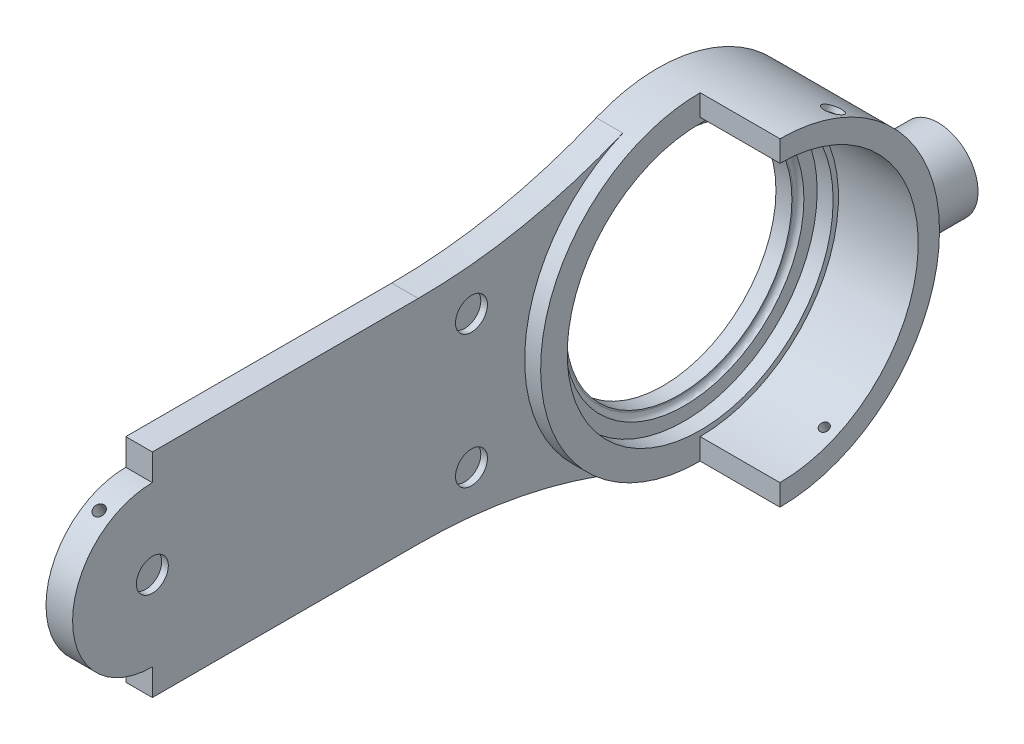
from build123d import *

# Parameters (mm, degrees)
SKETCH1_R                                            = 60
SKETCH1_R_2                                          = 45
SKETCH1_R_3                                          = 40
BOSS_EXTRUDE3_DEPTH                                  = 10
SKETCH4_R                                            = 60
SKETCH4_R_2                                          = 50
BOSS_EXTRUDE4_DEPTH                                  = 6
SKETCH5_R                                            = 45
SKETCH5_R_2                                          = 42.5
BOSS_EXTRUDE5_DEPTH                                  = 8
FILLET1_R                                            = 2
SKETCH6_R                                            = 52.5
SKETCH6_R_2                                          = 42.5
CUT_EXTRUDE2_DEPTH                                   = 2
BOSS_EXTRUDE6_DEPTH                                  = 30
BOSS_EXTRUDE7_REACH                                  = 311.38
SKETCH8_R                                            = 20.5
SKETCH9_R                                            = 15
BOSS_EXTRUDE8_DEPTH                                  = 20
CUT_EXTRUDE3_DEPTH                                   = 250.99199991
CBORE_FOR_M3_HEXAGON_HEAD_BOLTS_FULL_THR_D           = 3.4
CBORE_FOR_M3_HEXAGON_HEAD_BOLTS_FULL_THR_CBORE_D     = 7
CBORE_FOR_M3_HEXAGON_HEAD_BOLTS_FULL_THR_CBORE_DEPTH = 2
CBORE_FOR_M3_HEXAGON_HEAD_BOLTS_FULL_2_D             = 3.4
CBORE_FOR_M3_HEXAGON_HEAD_BOLTS_FULL_2_CBORE_D       = 7
CBORE_FOR_M3_HEXAGON_HEAD_BOLTS_FULL_2_CBORE_DEPTH   = 2
SKETCH17_R                                           = 2.05
CUT_EXTRUDE4_DEPTH                                   = 15
SKETCH18_R                                           = 2.05
CUT_EXTRUDE5_DEPTH                                   = 15
SKETCH19_R                                           = 6
CUT_EXTRUDE6_DEPTH                                   = 2.5
SKETCH20_R                                           = 6
CUT_EXTRUDE7_DEPTH                                   = 2.5


with BuildPart() as part:
    # Sketch1 → Boss-Extrude3 (new body)
    # profile 1 of 3: a face of its own
    with BuildSketch(Plane(origin=(0, 0, 0), x_dir=(0, 0, -1), z_dir=(1, 0, 0))):
        Circle(SKETCH1_R)
        Circle(SKETCH1_R_2, mode=Mode.SUBTRACT)
    # profile 2 of 3: a face of its own
    with BuildSketch(Plane(origin=(0, 0, 0), x_dir=(0, 0, -1), z_dir=(1, 0, 0))):
        with BuildLine():
            ThreePointArc((-23.076923077, 55.384615385), (-60.776772972, 43.883864862), (-100, 40))
            Line((-100, 40), (-200, 40))
            ThreePointArc((-200, 40), (-171.715728753, 28.284271247), (-160, 0))
            ThreePointArc((-160, 0), (-171.715728753, -28.284271247), (-200, -40))
            Line((-200, -40), (-100, -40))
            ThreePointArc((-100, -40), (-60.776772972, -43.883864862), (-23.076923077, -55.384615385))
            ThreePointArc((-23.076923077, -55.384615385), (-60, 0), (-23.076923077, 55.384615385))
        make_face()
    # profile 3 of 3: a face of its own
    with BuildSketch(Plane(origin=(0, 0, 0), x_dir=(0, 0, -1), z_dir=(1, 0, 0))):
        with Locations((-200, 0)):
            Circle(SKETCH1_R_3)
    extrude(amount=BOSS_EXTRUDE3_DEPTH)

    # Sketch4 → Boss-Extrude4 (add)
    with BuildSketch(Plane(origin=(10, 0, 0), x_dir=(0, 0, -1), z_dir=(1, 0, 0))):
        with Locations(Location((0, 0, 0), (0, 0, 112.619864948))):
            Circle(SKETCH4_R)
        Circle(SKETCH4_R_2, mode=Mode.SUBTRACT)
    extrude(amount=BOSS_EXTRUDE4_DEPTH)

    # Sketch5 → Boss-Extrude5 (add)
    with BuildSketch(Plane.ZY):
        with Locations(Location((0, 0, 0), (0, 0, 180))):
            Circle(SKETCH5_R)
        Circle(SKETCH5_R_2, mode=Mode.SUBTRACT)
    extrude(amount=-BOSS_EXTRUDE5_DEPTH)

    # Fillet1
    fillet1_edges = [part.edges().sort_by_distance(p)[0] for p in [
        (8, 0, 45),
    ]]
    fillet(fillet1_edges, radius=FILLET1_R - 0.0001)  # a hair under: the kernel refuses the full size

    # Sketch6 → Cut-Extrude2 (cut)
    with BuildSketch(Plane.ZY):
        Circle(SKETCH6_R)
        Circle(SKETCH6_R_2, mode=Mode.SUBTRACT)
    extrude(amount=-CUT_EXTRUDE2_DEPTH, mode=Mode.SUBTRACT)

    # Sketch7 → Boss-Extrude6 (add)
    with BuildSketch(Plane(origin=(16, 0, 0), x_dir=(0, 0, -1), z_dir=(1, 0, 0))):
        with BuildLine():
            ThreePointArc((60, 0), (42.426406871, 42.426406871), (0, 60))
            Line((0, 60), (0, 52))
            ThreePointArc((0, 52), (52, 0), (0, -52))
            Line((0, -52), (0, -60))
            ThreePointArc((0, -60), (42.426406871, -42.426406871), (60, 0))
        make_face()
    extrude(amount=BOSS_EXTRUDE6_DEPTH)

    # Sketch8 → Boss-Extrude7 (add, up to next)
    with BuildSketch(Plane(origin=(0, 0, -60), x_dir=(-1, 0, 0), z_dir=(0, 0, -1)), mode=Mode.PRIVATE) as boss_extrude7_sk1:
        with Locations((-25.5, 0)):
            Circle(SKETCH8_R)
    boss_extrude7_tool1 = extrude(boss_extrude7_sk1.sketch, amount=-BOSS_EXTRUDE7_REACH, mode=Mode.PRIVATE) - part.part
    add(boss_extrude7_tool1.solids().sort_by_distance((25.5, 0, -60))[0])
    add(boss_extrude7_tool1.solids().sort_by_distance((25.5, 0, -60))[1])

    # Sketch9 → Boss-Extrude8 (add)
    with BuildSketch(Plane(origin=(0, 0, -60), x_dir=(-1, 0, 0), z_dir=(0, 0, -1))):
        with Locations((-25.5, 0)):
            Circle(SKETCH9_R)
    extrude(amount=BOSS_EXTRUDE8_DEPTH)

    # Sketch12 → Cut-Extrude3 (cut, through all)
    with BuildSketch(Plane(origin=(10, 0, 0), x_dir=(0, 0, -1), z_dir=(1, 0, 0))):
        with BuildLine():
            Line((-200, 30), (-200, 40))
            ThreePointArc((-200, 40), (-240, 0), (-200, -40))
            Line((-200, -40), (-200, -30))
            ThreePointArc((-200, -30), (-230, 0), (-200, 30))
        make_face()
    extrude(amount=-CUT_EXTRUDE3_DEPTH, mode=Mode.SUBTRACT)

    # CBORE for M3 Hexagon head bolts-Full thread-grades AB2 (through all)
    with Locations(Plane(origin=(41, 54.543560573, -25), x_dir=(0, 0.416666666667, 0.909059342886), z_dir=(0, 0.909059342886, -0.416666666667))):
        with Locations((0, 0)):
            CounterBoreHole(CBORE_FOR_M3_HEXAGON_HEAD_BOLTS_FULL_THR_D / 2, CBORE_FOR_M3_HEXAGON_HEAD_BOLTS_FULL_THR_CBORE_D / 2, CBORE_FOR_M3_HEXAGON_HEAD_BOLTS_FULL_THR_CBORE_DEPTH)

    # CBORE for M3 Hexagon head bolts-Full 2 (through all)
    with Locations(Plane(origin=(41, -54.543560573, -25), x_dir=(0, 0.416667072006, -0.909059157099), z_dir=(0, -0.909059157099, -0.416667072006))):
        with Locations((0, 0)):
            CounterBoreHole(CBORE_FOR_M3_HEXAGON_HEAD_BOLTS_FULL_2_D / 2, CBORE_FOR_M3_HEXAGON_HEAD_BOLTS_FULL_2_CBORE_D / 2, CBORE_FOR_M3_HEXAGON_HEAD_BOLTS_FULL_2_CBORE_DEPTH)

    # Sketch17 → Cut-Extrude4 (cut)
    with BuildSketch(Plane(origin=(0, -119.511505722, 69), x_dir=(-1, 0, 0), z_dir=(0, -0.8660254037844414, 0.49999999999999517))):
        with Locations(Location((-5, -173.205080757, 0), (0, 0, 90))):
            Circle(SKETCH17_R)
    extrude(amount=-CUT_EXTRUDE4_DEPTH, mode=Mode.SUBTRACT)

    # Sketch18 → Cut-Extrude5 (cut)
    with BuildSketch(Plane(origin=(0, 119.511505722, 69), x_dir=(1, 0, 0), z_dir=(0, 0.8660254037844414, 0.49999999999999517))):
        with Locations(Location((5, -173.205080757, 0), (0, 0, 270))):
            Circle(SKETCH18_R)
    extrude(amount=-CUT_EXTRUDE5_DEPTH, mode=Mode.SUBTRACT)

    # Sketch19 → Cut-Extrude6 (cut)
    with BuildSketch(Plane(origin=(10, 0, 0), x_dir=(0, 0, -1), z_dir=(1, 0, 0))):
        with Locations((-200, 0)):
            Circle(SKETCH19_R)
    extrude(amount=-CUT_EXTRUDE6_DEPTH, mode=Mode.SUBTRACT)

    # Sketch20 → Cut-Extrude7 (cut)
    with BuildSketch(Plane(origin=(10, 0, 0), x_dir=(0, 0, -1), z_dir=(1, 0, 0))):
        with Locations((-80, -25)):
            Circle(SKETCH20_R)
        with Locations((-80, 25)):
            Circle(SKETCH20_R)
    extrude(amount=-CUT_EXTRUDE7_DEPTH, mode=Mode.SUBTRACT)


solid = part.part
